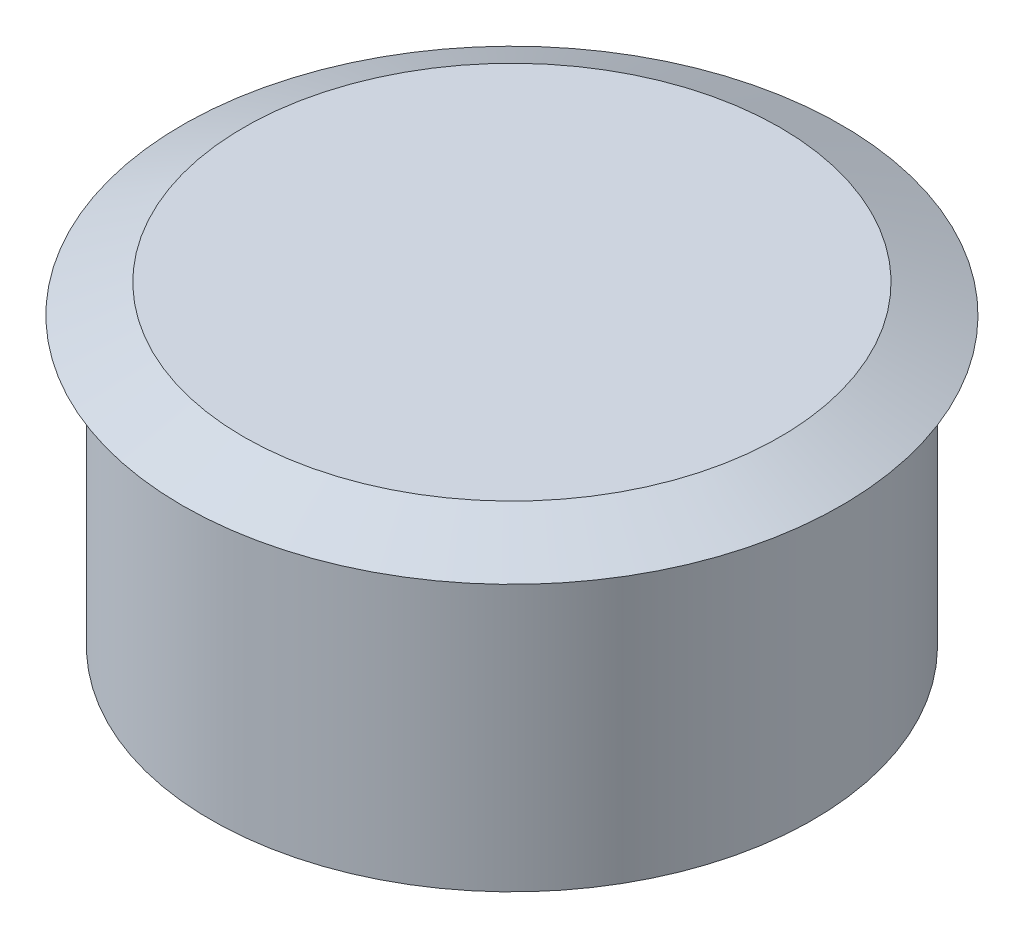
from build123d import *

# Parameters (mm, degrees)
SKETCH1_R               = 11.5
BOSS_EXTRUDE3_DEPTH     = 1
BOSS_EXTRUDE3_TAPER     = 65
BOSS_EXTRUDE5_START     = -10
BOSS_EXTRUDE5_OUTLINE_R = 10.5
BOSS_EXTRUDE5_DEPTH     = 10


# Read off the part's stored shape, not the designer's step: Boss-Extrude5
with BuildPart() as part:
    # Sketch1 → Boss-Extrude3 (new body)
    with BuildSketch(Plane(origin=(0, 0, 0), x_dir=(1, 0, 0), z_dir=(0, 1, 0))):
        Circle(SKETCH1_R)
    extrude(amount=BOSS_EXTRUDE3_DEPTH, taper=BOSS_EXTRUDE3_TAPER)

    # Boss-Extrude5 outline → Boss-Extrude5 (add)
    with BuildSketch(Plane(origin=(0, 0, 0), x_dir=(1, 0, 0), z_dir=(0, 1, 0)).offset(BOSS_EXTRUDE5_START)):
        Circle(BOSS_EXTRUDE5_OUTLINE_R)
    extrude(amount=BOSS_EXTRUDE5_DEPTH)


solid = part.part
